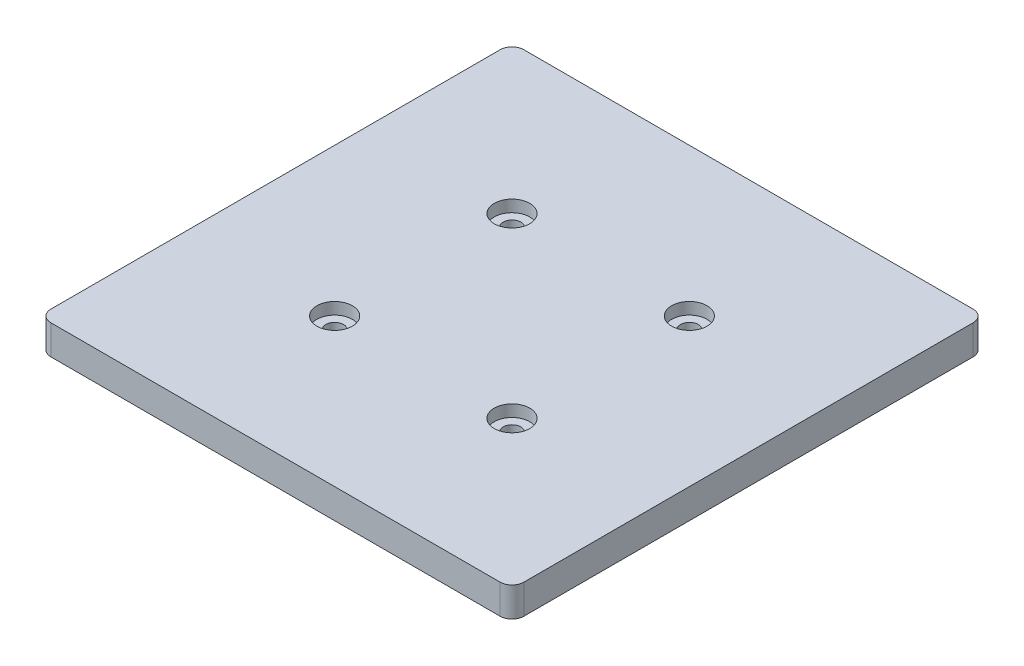
from build123d import *

# Parameters (mm, degrees)
ESQUISSE1_W             = 80
ESQUISSE1_H             = 80
ESQUISSE1_R             = 1.5
EXTRUSION1_DEPTH        = 5
ESQUISSE2_R             = 3
ENL_V_MAT_EXTRU_1_DEPTH = 2
CONG_1_R                = 2


with BuildPart() as part:
    # Esquisse1 → Extrusion1 (new body)
    with BuildSketch(Plane(origin=(0, 0, 0), x_dir=(1, 0, 0), z_dir=(0, 1, 0))):
        Rectangle(ESQUISSE1_W, ESQUISSE1_H)
        with Locations((-15, 15)):
            Circle(ESQUISSE1_R, mode=Mode.SUBTRACT)
        with Locations((15, 15)):
            Circle(ESQUISSE1_R, mode=Mode.SUBTRACT)
        with Locations((-15, -15)):
            Circle(ESQUISSE1_R, mode=Mode.SUBTRACT)
        with Locations((15, -15)):
            Circle(ESQUISSE1_R, mode=Mode.SUBTRACT)
    extrude(amount=EXTRUSION1_DEPTH)

    # Esquisse2 → Enlèv. mat.-Extru.1 (cut)
    with BuildSketch(Plane(origin=(0, 5, 0), x_dir=(1, 0, 0), z_dir=(0, 1, 0))):
        with Locations((-15, 15)):
            Circle(ESQUISSE2_R)
        with Locations((15, 15)):
            Circle(ESQUISSE2_R)
        with Locations((15, -15)):
            Circle(ESQUISSE2_R)
        with Locations((-15, -15)):
            Circle(ESQUISSE2_R)
    extrude(amount=-ENL_V_MAT_EXTRU_1_DEPTH, mode=Mode.SUBTRACT)

    # Congé1
    cong_1_edges = [part.edges().sort_by_distance(p)[0] for p in [
        (40, 2.5, -40),
        (-40, 2.5, -40),
        (-40, 2.5, 40),
        (40, 2.5, 40),
    ]]
    fillet(cong_1_edges, radius=CONG_1_R)


solid = part.part
